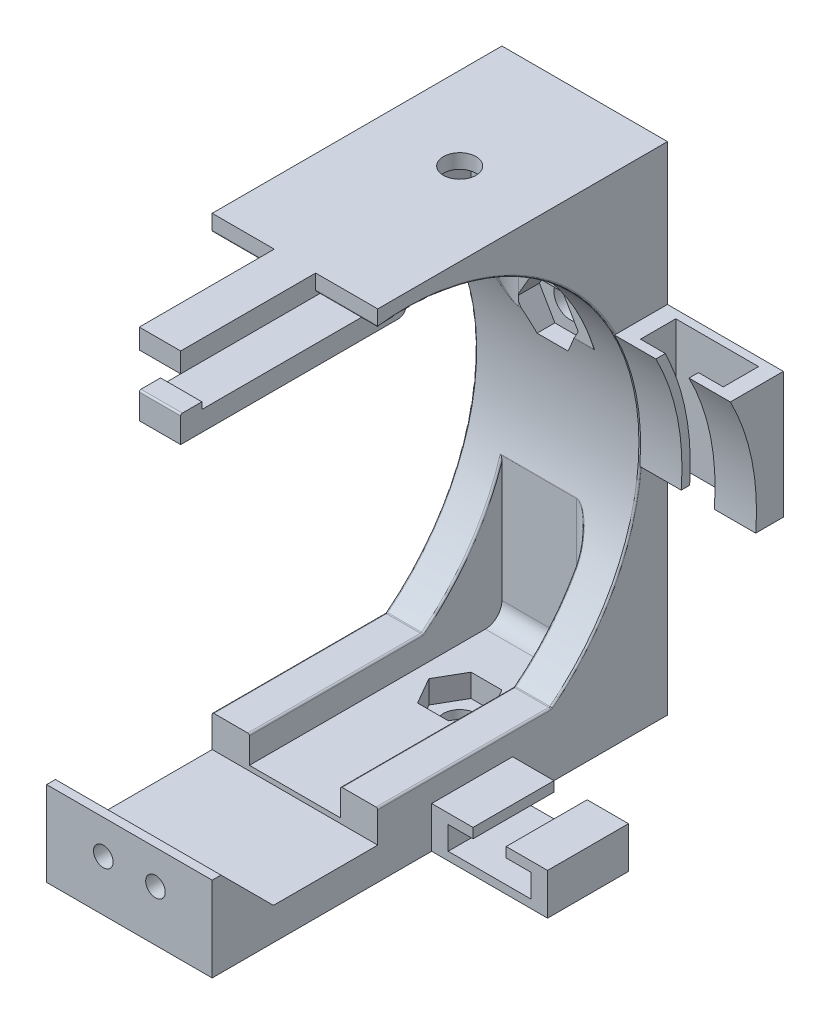
from build123d import *

# Parameters (mm, degrees)
SKETCH1_W                = 25.4
SKETCH1_H                = 76.2
BOSS_EXTRUDE1_DEPTH      = 44.45
SHELL1_T                 = -5.715
CUT_EXTRUDE3_DEPTH       = 64.816710194
CUT_EXTRUDE3_DEPTH_BACK  = 64.816710194
CUT_EXTRUDE4_DEPTH       = 90.126497182
CUT_EXTRUDE4_DEPTH_BACK  = 90.126497182
SKETCH4_R                = 2.5
CUT_EXTRUDE5_DEPTH       = 56.796955338
CUT_EXTRUDE5_DEPTH_BACK  = 56.796955338
SKETCH5_R                = 2.5
FILLET1_R                = 2.54
FILLET2_R                = 0.254
SKETCH7_R                = 2.5
CUT_EXTRUDE6_DEPTH       = 3.5
SKETCH8_R                = 2.5
CUT_EXTRUDE7_DEPTH       = 3.5
CUT_EXTRUDE8_START       = -3.5
SKETCH9_R                = 2.5
CUT_EXTRUDE8_DEPTH       = 3.5
SKETCH10_W               = 2.54
SKETCH10_H               = 6.35
BOSS_EXTRUDE2_DEPTH      = 3.175
SKETCH11_W               = 25.4
SKETCH11_H               = 4.953
BOSS_EXTRUDE3_DEPTH      = 25.4
SKETCH13_W               = 25.4
SKETCH13_H               = 13
BOSS_EXTRUDE6_DEPTH      = 1.27
CHAMFER1_SIZE            = 8.128
CUT_EXTRUDE9_REACH       = 82.572
SKETCH14_R               = 1.5
CUT_EXTRUDE10_START      = -2.54
CUT_EXTRUDE10_DEPTH      = 12.7
SKETCH16_W               = 17.78
SKETCH16_H               = 19.376660382
BOSS_EXTRUDE7_DEPTH      = 1.27
BOSS_EXTRUDE8_REACH      = 86.166
BOSS_EXTRUDE8_END_RADIUS = 35.841170706
SKETCH17_W               = 2.54
SKETCH17_H               = 19.376660382
BOSS_EXTRUDE9_START      = 3.81
BOSS_EXTRUDE9_DEPTH      = 3.81
BOSS_EXTRUDE10_DEPTH     = 3.81
SKETCH20_W               = 17.78
SKETCH20_H               = 12.418914627
BOSS_EXTRUDE11_DEPTH     = 1.27
SKETCH21_W               = 2.54
SKETCH21_H               = 12.418914627
BOSS_EXTRUDE12_DEPTH     = 5.08
SKETCH22_W               = 12.418914627
SKETCH22_H               = 1.524
BOSS_EXTRUDE13_DEPTH     = 3.81
SKETCH23_W               = 12.418914627
SKETCH23_H               = 1.524
BOSS_EXTRUDE14_DEPTH     = 3.81


with BuildPart() as part:
    # Sketch1 → Boss-Extrude1 (new body)
    with BuildSketch(Plane.XY):
        Rectangle(SKETCH1_W, SKETCH1_H)
    extrude(amount=BOSS_EXTRUDE1_DEPTH)

    # Shell1
    shell1_openings = [part.faces().sort_by_distance(p)[0] for p in [
        (0, 0, 44.45),
    ]]
    offset(amount=SHELL1_T, openings=shell1_openings, kind=Kind.INTERSECTION)

    # Sketch2 → Cut-Extrude3 (cut, two sides: drawn at the far end of the back side and taken through both)
    with BuildSketch(Plane(origin=(12.7, 0, 0), x_dir=(0, 0, -1), z_dir=(1, 0, 0)).offset(-CUT_EXTRUDE3_DEPTH_BACK)):
        with BuildLine():
            ThreePointArc((-17.866507193, -28.214399579), (-5.549706062, 9.993761623), (-36.413720818, 35.664362817))
            Line((-36.413720818, 35.664362817), (-36.413720818, -28.214399579))
            Line((-36.413720818, -28.214399579), (-17.866507193, -28.214399579))
        make_face()
        with BuildLine():
            Line((-36.413720818, -28.214399579), (-36.413720818, 35.664362817))
            ThreePointArc((-36.413720818, 35.664362817), (-40.434794926, 35.838148814), (-44.45, 35.56))
            Line((-44.45, 35.56), (-44.45, -28.214399579))
            Line((-44.45, -28.214399579), (-36.413720818, -28.214399579))
        make_face()
    extrude(amount=CUT_EXTRUDE3_DEPTH + CUT_EXTRUDE3_DEPTH_BACK, mode=Mode.SUBTRACT)

    # Sketch4 → Cut-Extrude4 (cut, two sides: drawn at the far end of the back side and taken through both)
    with BuildSketch(Plane(origin=(0, 38.1, 0), x_dir=(1, 0, 0), z_dir=(0, 1, 0)).offset(-CUT_EXTRUDE4_DEPTH_BACK)):
        with Locations(Location((0, -19.177, 0), (0, 0, 270))):
            Circle(SKETCH4_R)
    extrude(amount=CUT_EXTRUDE4_DEPTH + CUT_EXTRUDE4_DEPTH_BACK, mode=Mode.SUBTRACT)

    # Sketch5 → Cut-Extrude5 (cut, two sides: drawn at the far end of the back side and taken through both)
    with BuildSketch(Plane.XY.offset(5.715).offset(-CUT_EXTRUDE5_DEPTH_BACK)):
        with Locations((0, 11.684)):
            Circle(SKETCH5_R)
    extrude(amount=CUT_EXTRUDE5_DEPTH + CUT_EXTRUDE5_DEPTH_BACK, mode=Mode.SUBTRACT)

    # Fillet1
    fillet1_edges = [part.edges().sort_by_distance(p)[0] for p in [
        (6.985, -21.465702955, 5.715),
        (0, 32.385, 5.715),
        (-6.985, 21.465702955, 5.715),
        (0, -32.385, 5.715),
    ]]
    fillet(fillet1_edges, radius=FILLET1_R)

    # Fillet2
    fillet2_edges = [part.edges().sort_by_distance(p)[0] for p in [
        (-6.985, -28.214399579, 31.158253597),
        (6.985, -28.214399579, 31.158253597),
        (9.8425, -28.214399579, 17.866507193),
        (6.985, -22.964147422, 12.451436452),
        (-6.985, -20.31046017, 10.438472893),
        (0, 35.56, 44.45),
        (12.7, 13.789850755, 6.887220867),
        (6.985, 23.45347117, 12.867277174),
        (0, 32.385, 24.613561487),
        (-6.985, 25.868117579, 15.161522376),
        (-12.7, -28.214399579, 31.158253597),
        (-9.8425, -28.214399579, 17.866507193),
        (-12.7, 13.789850755, 6.887220867),
        (12.7, -28.214399579, 31.158253597),
        (4.605590257, 10.546405909, 5.715),
        (0, 9.184, 5.32485132),
        (-3.335590257, 10.546405909, 5.715),
        (-1.27, -10.546405909, 5.715),
        (6.453749331, -13.333029041, 6.700482036),
        (-6.453749331, 13.333029041, 6.700482036),
    ]]
    fillet(fillet2_edges, radius=FILLET2_R)

    # Sketch7 → Cut-Extrude6 (cut)
    with BuildSketch(Plane(origin=(0, -32.385, 0), x_dir=(1, 0, 0), z_dir=(0, 1, 0))):
        Polygon((-2.367136104, -23.277), (2.367136104, -23.277), (4.734272207, -19.177), (2.367136104, -15.077), (-2.367136104, -15.077), (-4.734272207, -19.177), align=None)
        with Locations(Location((0, -19.177, 0), (0, 0, 270))):
            Circle(SKETCH7_R, mode=Mode.SUBTRACT)
    extrude(amount=-CUT_EXTRUDE6_DEPTH, mode=Mode.SUBTRACT)

    # Sketch8 → Cut-Extrude7 (cut)
    with BuildSketch(Plane.XY.offset(5.715)):
        Polygon((4.734272207, 11.684), (2.367136104, 15.784), (-2.367136104, 15.784), (-4.734272207, 11.684), (-2.367136104, 7.584), (2.367136104, 7.584), align=None)
        with Locations((0, 11.684)):
            Circle(SKETCH8_R, mode=Mode.SUBTRACT)
    extrude(amount=-CUT_EXTRUDE7_DEPTH, mode=Mode.SUBTRACT)

    # Sketch9 → Cut-Extrude8 (cut)
    with BuildSketch(Plane.XZ.offset(-32.385).offset(CUT_EXTRUDE8_START)):
        Polygon((2.367136104, 15.077), (4.734272207, 19.177), (2.367136104, 23.277), (-2.367136104, 23.277), (-4.734272207, 19.177), (-2.367136104, 15.077), align=None)
        with Locations(Location((0, 19.177, 0), (0, 0, 90))):
            Circle(SKETCH9_R, mode=Mode.SUBTRACT)
    extrude(amount=CUT_EXTRUDE8_DEPTH, mode=Mode.SUBTRACT)

    # Sketch10 → Boss-Extrude2 (add, symmetric)
    with BuildSketch(Plane(origin=(0, 0, 0), x_dir=(0, 0, -1), z_dir=(1, 0, 0))):
        Polygon((-30.529506667, 35.052), (-30.529506667, 38.1), (-65.157426577, 38.1), (-65.157426577, 35.052), (-33.069506667, 35.052), align=None)
        with Locations((-31.799506667, 31.877)):
            Rectangle(SKETCH10_W, SKETCH10_H)
        with BuildLine():
            Line((-30.529506667, 26.924), (-30.529506667, 28.702))
            Line((-30.529506667, 28.702), (-33.069506667, 28.702))
            Line((-33.069506667, 28.702), (-61.900873737, 28.702))
            Line((-61.900873737, 28.702), (-65.157426577, 28.702))
            Line((-65.157426577, 28.702), (-65.157426577, 25.654))
            Line((-65.157426577, 25.654), (-31.799506667, 25.654))
            ThreePointArc((-31.799506667, 25.654), (-30.901481055, 26.025974388), (-30.529506667, 26.924))
        make_face()
        with BuildLine():
            Line((-65.157426577, 28.702), (-61.900873737, 28.702))
            Line((-61.900873737, 28.702), (-61.900873737, 29.718))
            Line((-61.900873737, 29.718), (-64.903426577, 29.718))
            ThreePointArc((-64.903426577, 29.718), (-65.083031699, 29.643605122), (-65.157426577, 29.464))
            Line((-65.157426577, 29.464), (-65.157426577, 28.702))
        make_face()
    extrude(amount=BOSS_EXTRUDE2_DEPTH, both=True)

    # Sketch11 → Boss-Extrude3 (add)
    with BuildSketch(Plane.XY.offset(44.45)):
        with Locations((0, -35.6235)):
            Rectangle(SKETCH11_W, SKETCH11_H)
    extrude(amount=BOSS_EXTRUDE3_DEPTH)

    # Sketch13 → Boss-Extrude6 (add)
    with BuildSketch(Plane.XY.offset(69.85)):
        with Locations((0, -31.6)):
            Rectangle(SKETCH13_W, SKETCH13_H)
    extrude(amount=-BOSS_EXTRUDE6_DEPTH)

    # Chamfer1
    # the kernel refuses this chamfer: 8.128 mm, written as the material it adds along each edge
    with BuildSketch(Plane(origin=(12.7, -33.147, 68.58), x_dir=(0, -0.027495876610586435, -0.9996219169112968), z_dir=(-1, 0, 0))) as chamfer1_piece_1_section:
        Polygon((CHAMFER1_SIZE * 0.999621916911, -CHAMFER1_SIZE * 0.0274958766106), (-CHAMFER1_SIZE * 0.0274958766106, -CHAMFER1_SIZE * 0.999621916911), (0, 0), align=None)
    chamfer1_piece_1 = extrude(amount=25.4, mode=Mode.PRIVATE)
    chamfer1_piece_1 = split(chamfer1_piece_1, bisect_by=Plane(origin=(0, -25.1, 65.891857513), z_dir=(0, -1, 0)), keep=Keep.TOP, mode=Mode.PRIVATE)
    add(chamfer1_piece_1)

    # Cut-Extrude9: up to this plane
    cut_extrude9_end = Plane(origin=(0, -25.019, 68.58), z_dir=(0, 0.7071067811865439, -0.7071067811865512))
    # Sketch14 → Cut-Extrude9 (cut, up to the surface)
    with BuildSketch(Plane.XY.offset(69.85), mode=Mode.PRIVATE) as cut_extrude9_sk1:
        with Locations((-4, -30.297047814)):
            Circle(SKETCH14_R)
    cut_extrude9_tool1 = split(extrude(cut_extrude9_sk1.sketch, amount=-CUT_EXTRUDE9_REACH, mode=Mode.PRIVATE), bisect_by=cut_extrude9_end, keep=Keep.BOTH, mode=Mode.PRIVATE)
    add(cut_extrude9_tool1.solids().sort_by_distance((-4, -30.297048, 69.85))[0], mode=Mode.SUBTRACT)
    # Sketch14 → Cut-Extrude9 (cut, up to the surface)
    with BuildSketch(Plane.XY.offset(69.85), mode=Mode.PRIVATE) as cut_extrude9_sk2:
        with Locations((4, -30.297047814)):
            Circle(SKETCH14_R)
    cut_extrude9_tool2 = split(extrude(cut_extrude9_sk2.sketch, amount=-CUT_EXTRUDE9_REACH, mode=Mode.PRIVATE), bisect_by=cut_extrude9_end, keep=Keep.BOTH, mode=Mode.PRIVATE)
    add(cut_extrude9_tool2.solids().sort_by_distance((4, -30.297048, 69.85))[0], mode=Mode.SUBTRACT)

    # Sketch15 → Cut-Extrude10 (cut)
    with BuildSketch(Plane.XY.offset(69.85).offset(CUT_EXTRUDE10_START)):
        Polygon((-2.36898549, -27.472047814), (-5.63101451, -27.472047814), (-7.262029021, -30.297047814), (-5.63101451, -33.122047814), (-2.36898549, -33.122047814), (-0.737970979, -30.297047814), align=None)
        Polygon((5.63101451, -27.472047814), (2.36898549, -27.472047814), (0.737970979, -30.297047814), (2.36898549, -33.122047814), (5.63101451, -33.122047814), (7.262029021, -30.297047814), align=None)
    extrude(amount=-CUT_EXTRUDE10_DEPTH, mode=Mode.SUBTRACT)

    # Sketch16 → Boss-Extrude7 (add)
    with BuildSketch(Plane.XY):
        with Locations((21.59, 6.774917399)):
            Rectangle(SKETCH16_W, SKETCH16_H)
    extrude(amount=BOSS_EXTRUDE7_DEPTH)

    # Boss-Extrude8: up to this cylinder (the profile starts outside it)
    boss_extrude8_end = Plane(origin=(21.59, 0, 39.969384244), z_dir=(1, 0, 0)) * Cylinder(BOSS_EXTRUDE8_END_RADIUS, 260.254341411, mode=Mode.PRIVATE)
    # Sketch17 → Boss-Extrude8 (add, up to the surface)
    with BuildSketch(Plane.XY.offset(1.27), mode=Mode.PRIVATE) as boss_extrude8_sk1:
        with Locations((29.21, 6.774917399)):
            Rectangle(SKETCH17_W, SKETCH17_H)
    boss_extrude8_tool1 = extrude(boss_extrude8_sk1.sketch, amount=BOSS_EXTRUDE8_REACH, mode=Mode.PRIVATE) - boss_extrude8_end
    add(boss_extrude8_tool1.solids().sort_by_distance((29.21, 6.774917, 1.27))[0])
    # Sketch17 → Boss-Extrude8 (add, up to the surface)
    with BuildSketch(Plane.XY.offset(1.27), mode=Mode.PRIVATE) as boss_extrude8_sk2:
        with Locations((13.97, 6.774917399)):
            Rectangle(SKETCH17_W, SKETCH17_H)
    boss_extrude8_tool2 = extrude(boss_extrude8_sk2.sketch, amount=BOSS_EXTRUDE8_REACH, mode=Mode.PRIVATE) - boss_extrude8_end
    add(boss_extrude8_tool2.solids().sort_by_distance((13.97, 6.774917, 1.27))[0])

    # Sketch18 → Boss-Extrude9 (add)
    with BuildSketch(Plane(origin=(15.24, 0, 0), x_dir=(0, 0, -1), z_dir=(1, 0, 0)).offset(BOSS_EXTRUDE9_START)):
        with BuildLine():
            ThreePointArc((-8.13306856, 16.46324759), (-4.828037069, 7.048066138), (-4.246820738, -2.913412792))
            Line((-4.246820738, -2.913412792), (-2.950914716, -2.913412792))
            Line((-2.950914716, -2.913412792), (-2.894619437, -1.643412792))
            ThreePointArc((-2.894619437, -1.643412792), (-3.517312387, 6.963149319), (-6.110792737, 15.19324759))
            Line((-6.110792737, 15.19324759), (-6.680675405, 16.46324759))
            Line((-6.680675405, 16.46324759), (-8.13306856, 16.46324759))
        make_face()
    extrude(amount=-BOSS_EXTRUDE9_DEPTH)

    # Sketch19 → Boss-Extrude10 (add)
    with BuildSketch(Plane.ZY.offset(-27.94)):
        with BuildLine():
            Line((2.894619437, -1.643412792), (2.950914716, -2.913412792))
            Line((2.950914716, -2.913412792), (4.246820738, -2.913412792))
            ThreePointArc((4.246820738, -2.913412792), (4.828037069, 7.048066138), (8.13306856, 16.46324759))
            Line((8.13306856, 16.46324759), (6.680675405, 16.46324759))
            Line((6.680675405, 16.46324759), (6.110792737, 15.19324759))
            ThreePointArc((6.110792737, 15.19324759), (3.517312387, 6.963149319), (2.894619437, -1.643412792))
        make_face()
    extrude(amount=BOSS_EXTRUDE10_DEPTH)

    # Sketch20 → Boss-Extrude11 (add)
    with BuildSketch(Plane.XZ.offset(38.1)):
        with Locations((21.59, 29.970703389)):
            Rectangle(SKETCH20_W, SKETCH20_H)
    extrude(amount=-BOSS_EXTRUDE11_DEPTH)

    # Sketch21 → Boss-Extrude12 (add)
    with BuildSketch(Plane(origin=(0, -36.83, 0), x_dir=(1, 0, 0), z_dir=(0, 1, 0))):
        with Locations((13.97, -29.970703389)):
            Rectangle(SKETCH21_W, SKETCH21_H)
        with Locations((29.21, -29.970703389)):
            Rectangle(SKETCH21_W, SKETCH21_H)
    extrude(amount=BOSS_EXTRUDE12_DEPTH)

    # Sketch22 → Boss-Extrude13 (add)
    with BuildSketch(Plane(origin=(15.24, 0, 0), x_dir=(0, 0, -1), z_dir=(1, 0, 0))):
        with Locations((-29.970703389, -32.512)):
            Rectangle(SKETCH22_W, SKETCH22_H)
    extrude(amount=BOSS_EXTRUDE13_DEPTH)

    # Sketch23 → Boss-Extrude14 (add)
    with BuildSketch(Plane.ZY.offset(-27.94)):
        with Locations((29.970703389, -32.512)):
            Rectangle(SKETCH23_W, SKETCH23_H)
    extrude(amount=BOSS_EXTRUDE14_DEPTH)


solid = part.part
